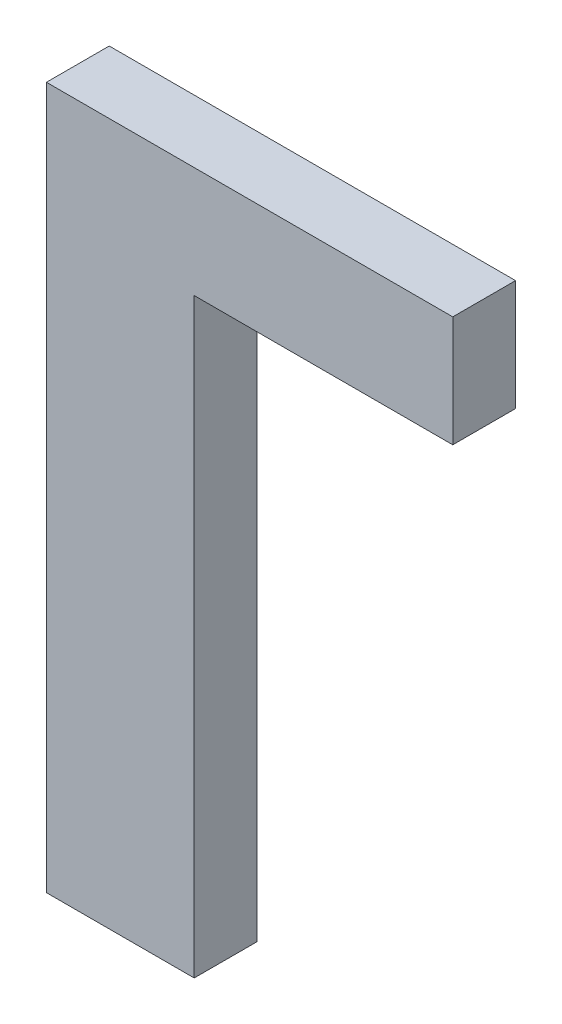
from build123d import *

# Parameters (mm, degrees)
SKETCH1_W           = 10.16
SKETCH1_H           = 48.26
BOSS_EXTRUDE1_DEPTH = 4.318
SKETCH2_W           = 4.318
SKETCH2_H           = 7.62
BOSS_EXTRUDE2_DEPTH = 17.78


with BuildPart() as part:
    # Sketch1 → Boss-Extrude1 (new body)
    with BuildSketch(Plane.XY):
        Rectangle(SKETCH1_W, SKETCH1_H)
    extrude(amount=BOSS_EXTRUDE1_DEPTH)

    # Sketch2 → Boss-Extrude2 (add)
    with BuildSketch(Plane(origin=(5.08, 0, 0), x_dir=(0, 0, -1), z_dir=(1, 0, 0))):
        with Locations((-2.159, 20.32)):
            Rectangle(SKETCH2_W, SKETCH2_H)
    extrude(amount=BOSS_EXTRUDE2_DEPTH)


solid = part.part
